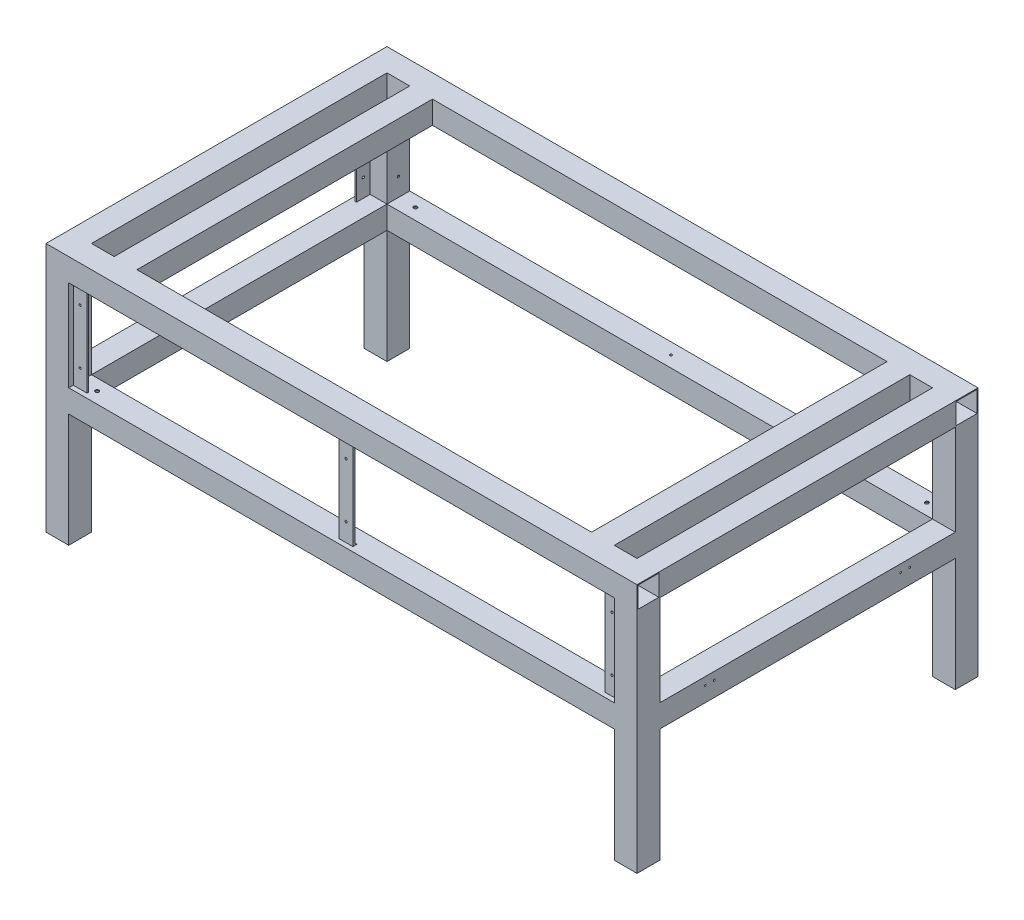
from build123d import *

# Parameters (mm, degrees)
ESQUISSE1_W                = 1300
ESQUISSE1_H                = 750
ESQUISSE1_W_2              = 1200
ESQUISSE1_H_2              = 650
BOSS_EXTRU_1_DEPTH         = 550
ESQUISSE2_W                = 1200
ESQUISSE2_H                = 200
ESQUISSE2_H_2              = 250
ENL_V_MAT_EXTRU_1_DEPTH    = 1599.436736315
ESQUISSE3_W                = 650
ESQUISSE3_H                = 200
ESQUISSE3_H_2              = 250
ENL_V_MAT_EXTRU_2_DEPTH    = 1599.436736315
ESQUISSE4_W                = 50
ESQUISSE4_H                = 650
BOSS_EXTRU_2_DEPTH         = 50
BOSS_EXTRU_2_2_DEPTH       = 50
ESQUISSE18_R               = 4
ENL_V_MAT_EXTRU_5_DEPTH    = 80
ESQUISSE19_R               = 15
ENL_V_MAT_EXTRU_6_DEPTH    = 48
ESQUISSE20_W               = 46
ESQUISSE20_H               = 46
ENL_V_MAT_EXTRU_7_DEPTH    = 10000
ESQUISSE21_W               = 46
ESQUISSE21_H               = 46
ENL_V_MAT_EXTRU_8_DEPTH    = 500
ESQUISSE22_W               = 30
ESQUISSE22_H               = 200
BOSS_EXTRU_11_DEPTH        = 3
ESQUISSE23_W               = 30
ESQUISSE23_H               = 200
ESQUISSE23_R               = 2.5
BOSS_EXTRU_12_DEPTH        = 3
ESQUISSE25_W               = 1000
ESQUISSE25_H               = 20
BOSS_EXTRU_14_DEPTH        = 3
ESQUISSE29_R               = 2.5
ENL_V_MAT_EXTRU_9_DEPTH    = 10
ESQUISSE30_R               = 2.5
ENL_V_MAT_EXTRU_10_DEPTH   = 15
ESQUISSE31_W               = 30
ESQUISSE31_H               = 5
BOSS_EXTRU_18_DEPTH        = 200
CONG_1_R                   = 5
ESQUISSE32_R               = 2.5
ENL_V_MAT_EXTRU_11_DEPTH   = 5
SYM_TRIE15_COPY_1_SKETCH_W = 30
SYM_TRIE15_COPY_1_SKETCH_H = 200
SYM_TRIE15_COPY_1_DEPTH    = 3
SYM_TRIE15_COPY_2_SKETCH_W = 30
SYM_TRIE15_COPY_2_SKETCH_H = 200
SYM_TRIE15_COPY_2_SKETCH_R = 2.5
SYM_TRIE15_COPY_2_DEPTH    = 3
SYM_TRIE15_COPY_3_SKETCH_W = 30
SYM_TRIE15_COPY_3_SKETCH_H = 200
SYM_TRIE15_COPY_3_DEPTH    = 3
SYM_TRIE15_COPY_4_SKETCH_W = 30
SYM_TRIE15_COPY_4_SKETCH_H = 200
SYM_TRIE15_COPY_4_SKETCH_R = 2.5
SYM_TRIE15_COPY_4_DEPTH    = 3
ESQUISSE33_W               = 80.648964208
ESQUISSE33_H               = 200
ENL_V_MAT_EXTRU_12_DEPTH   = 78
ESQUISSE34_R               = 2
ENL_V_MAT_EXTRU_13_DEPTH   = 25


with BuildPart() as part:
    # Esquisse1 → Boss.-Extru.1 (new body)
    with BuildSketch(Plane(origin=(0, 0, 0), x_dir=(1, 0, 0), z_dir=(0, 1, 0))):
        with Locations((650, 375)):
            Rectangle(ESQUISSE1_W, ESQUISSE1_H)
        with Locations((650, 375)):
            Rectangle(ESQUISSE1_W_2, ESQUISSE1_H_2, mode=Mode.SUBTRACT)
    extrude(amount=-BOSS_EXTRU_1_DEPTH)

    # Esquisse2 → Enlèv. mat.-Extru.1 (cut, through all)
    with BuildSketch(Plane.XY):
        with Locations((650, -150)):
            Rectangle(ESQUISSE2_W, ESQUISSE2_H)
        with Locations((650, -425)):
            Rectangle(ESQUISSE2_W, ESQUISSE2_H_2)
    extrude(amount=-ENL_V_MAT_EXTRU_1_DEPTH, mode=Mode.SUBTRACT)

    # Esquisse3 → Enlèv. mat.-Extru.2 (cut, through all)
    with BuildSketch(Plane.ZY):
        with Locations((-375, -150)):
            Rectangle(ESQUISSE3_W, ESQUISSE3_H)
        with Locations((-375, -425)):
            Rectangle(ESQUISSE3_W, ESQUISSE3_H_2)
    extrude(amount=-ENL_V_MAT_EXTRU_2_DEPTH, mode=Mode.SUBTRACT)

    # Esquisse18 → Enlèv. mat.-Extru.5 (cut)
    with BuildSketch(Plane(origin=(0, -250, 0), x_dir=(1, 0, 0), z_dir=(0, 1, 0))):
        with Locations((1212.5, 25)):
            Circle(ESQUISSE18_R)
        with Locations((87.5, 25)):
            Circle(ESQUISSE18_R)
        with Locations((87.5, 725)):
            Circle(ESQUISSE18_R)
        with Locations((1212.5, 725)):
            Circle(ESQUISSE18_R)
    extrude(amount=-ENL_V_MAT_EXTRU_5_DEPTH, mode=Mode.SUBTRACT)

    # Esquisse19 → Enlèv. mat.-Extru.6 (cut)
    with BuildSketch(Plane(origin=(0, -300, 0), x_dir=(-1, 0, 0), z_dir=(0, -1, 0))):
        with Locations((-1212.5, 725)):
            Circle(ESQUISSE19_R)
        with Locations((-87.5, 725)):
            Circle(ESQUISSE19_R)
        with Locations((-87.5, 25)):
            Circle(ESQUISSE19_R)
        with Locations((-1212.5, 25)):
            Circle(ESQUISSE19_R)
    extrude(amount=-ENL_V_MAT_EXTRU_6_DEPTH, mode=Mode.SUBTRACT)

    # Esquisse20 → Enlèv. mat.-Extru.7 (cut)
    with BuildSketch(Plane.ZY):
        with Locations((-25, -25)):
            Rectangle(ESQUISSE20_W, ESQUISSE20_H)
        with Locations((-725, -25)):
            Rectangle(ESQUISSE20_W, ESQUISSE20_H)
    extrude(amount=-ENL_V_MAT_EXTRU_7_DEPTH, mode=Mode.SUBTRACT)

    # Esquisse21 → Enlèv. mat.-Extru.8 (cut)
    with BuildSketch(Plane(origin=(0, -550, 0), x_dir=(-1, 0, 0), z_dir=(0, -1, 0))):
        with Locations((-1275, 25)):
            Rectangle(ESQUISSE21_W, ESQUISSE21_H)
        with Locations((-1275, 725)):
            Rectangle(ESQUISSE21_W, ESQUISSE21_H)
        with Locations((-25, 725)):
            Rectangle(ESQUISSE21_W, ESQUISSE21_H)
        with Locations((-25, 25)):
            Rectangle(ESQUISSE21_W, ESQUISSE21_H)
    extrude(amount=-ENL_V_MAT_EXTRU_8_DEPTH, mode=Mode.SUBTRACT)

    # Esquisse22 → Boss.-Extru.11 (add)
    with BuildSketch(Plane(origin=(0, 0, -50), x_dir=(-1, 0, 0), z_dir=(0, 0, -1))):
        with Locations((-25, -150)):
            Rectangle(ESQUISSE22_W, ESQUISSE22_H)
    boss_extru_11 = extrude(amount=BOSS_EXTRU_11_DEPTH)

    # Esquisse23 → Boss.-Extru.12 (add)
    with BuildSketch(Plane.ZY.offset(-10)):
        with Locations((-65, -150)):
            Rectangle(ESQUISSE23_W, ESQUISSE23_H)
        with Locations((-65, -90)):
            Circle(ESQUISSE23_R, mode=Mode.SUBTRACT)
        with Locations((-65, -210)):
            Circle(ESQUISSE23_R, mode=Mode.SUBTRACT)
    boss_extru_12 = extrude(amount=-BOSS_EXTRU_12_DEPTH)

    # Symétrie3: Boss.-Extru.11, Boss.-Extru.12 across plane
    add(boss_extru_11.mirror(Plane(origin=(0, 0, 0), x_dir=(-0.7071067811865475, 0, 0.7071067811865477), z_dir=(-0.7071067811865476, 0, -0.7071067811865475))))
    add(boss_extru_12.mirror(Plane(origin=(0, 0, 0), x_dir=(-0.7071067811865475, 0, 0.7071067811865477), z_dir=(-0.7071067811865476, 0, -0.7071067811865475))))



with BuildPart() as body_2:
    # Esquisse4 → Boss.-Extru.2 (new body)
    with BuildSketch(Plane(origin=(0, 0, 0), x_dir=(1, 0, 0), z_dir=(0, 1, 0))):
        with Locations((125, 375)):
            Rectangle(ESQUISSE4_W, ESQUISSE4_H)
    extrude(amount=-BOSS_EXTRU_2_DEPTH)


with BuildPart() as body_3:
    # Esquisse4 → Boss.-Extru.2 2 (new body)
    with BuildSketch(Plane(origin=(0, 0, 0), x_dir=(1, 0, 0), z_dir=(0, 1, 0))):
        with Locations((1175, 375)):
            Rectangle(ESQUISSE4_W, ESQUISSE4_H)
    extrude(amount=-BOSS_EXTRU_2_2_DEPTH)


with BuildPart() as part_1:
    add(part.part)

    add(body_2.part)  # Boss.-Extru.14 merges body 2

    add(body_3.part)  # Boss.-Extru.14 merges body 3
    # Esquisse25 → Boss.-Extru.14 (add)
    with BuildSketch(Plane(origin=(0, 0, -50), x_dir=(-1, 0, 0), z_dir=(0, 0, -1))):
        with Locations((-650, -15)):
            Rectangle(ESQUISSE25_W, ESQUISSE25_H)
    extrude(amount=BOSS_EXTRU_14_DEPTH)

    # Esquisse29 → Enlèv. mat.-Extru.9 (cut)
    with BuildSketch(Plane.ZY.offset(-1250)):
        with Locations((-725, -210)):
            Circle(ESQUISSE29_R)
        with Locations((-725, -90)):
            Circle(ESQUISSE29_R)
    enl_v_mat_extru_9 = extrude(amount=-ENL_V_MAT_EXTRU_9_DEPTH, mode=Mode.SUBTRACT)

    # Symétrie9: Enlèv. mat.-Extru.9 across plane
    add(enl_v_mat_extru_9.mirror(Plane.ZY.offset(-650)), mode=Mode.SUBTRACT)

    # Esquisse30 → Enlèv. mat.-Extru.10 (cut)
    with BuildSketch(Plane(origin=(0, -250, 0), x_dir=(1, 0, 0), z_dir=(0, 1, 0))):
        with Locations((650, 725)):
            Circle(ESQUISSE30_R)
    enl_v_mat_extru_10 = extrude(amount=-ENL_V_MAT_EXTRU_10_DEPTH, mode=Mode.SUBTRACT)

    # Symétrie10: Enlèv. mat.-Extru.10 across plane
    add(enl_v_mat_extru_10.mirror(Plane(origin=(0, -150, 0), x_dir=(0, 0, 1), z_dir=(0, -1, 0))), mode=Mode.SUBTRACT)

    # Esquisse31 → Boss.-Extru.18 (add)
    with BuildSketch(Plane(origin=(0, -250, 0), x_dir=(1, 0, 0), z_dir=(0, 1, 0))):
        with Locations((650, 12.5)):
            Rectangle(ESQUISSE31_W, ESQUISSE31_H)
    extrude(amount=BOSS_EXTRU_18_DEPTH)

    # Congé1
    cong_1_edges = [part_1.edges().sort_by_distance(p)[0] for p in [
        (650, -250, -15),
        (650, -50, -15),
    ]]
    fillet(cong_1_edges, radius=CONG_1_R)

    # Esquisse32 → Enlèv. mat.-Extru.11 (cut)
    with BuildSketch(Plane.XY.offset(-10)):
        with Locations((650, -210)):
            Circle(ESQUISSE32_R)
        with Locations((650, -90)):
            Circle(ESQUISSE32_R)
    extrude(amount=-ENL_V_MAT_EXTRU_11_DEPTH, mode=Mode.SUBTRACT)

    # Symétrie11: Boss.-Extru.12 across plane
    add(boss_extru_12.mirror(Plane.XY.offset(-375)))

    # Symétrie15 copy 1 sketch → Symétrie15 copy 1 (add)
    with BuildSketch(Plane.ZY.offset(-1250)):
        with Locations((-25, -150)):
            Rectangle(SYM_TRIE15_COPY_1_SKETCH_W, SYM_TRIE15_COPY_1_SKETCH_H)
    extrude(amount=SYM_TRIE15_COPY_1_DEPTH)

    # Symétrie15 copy 2 sketch → Symétrie15 copy 2 (add)
    with BuildSketch(Plane(origin=(1300, 0, -10), x_dir=(1, 0, 0), z_dir=(0, 0, 1))):
        with Locations((-65, -150)):
            Rectangle(SYM_TRIE15_COPY_2_SKETCH_W, SYM_TRIE15_COPY_2_SKETCH_H)
        with Locations((-65, -90)):
            Circle(SYM_TRIE15_COPY_2_SKETCH_R, mode=Mode.SUBTRACT)
        with Locations((-65, -210)):
            Circle(SYM_TRIE15_COPY_2_SKETCH_R, mode=Mode.SUBTRACT)
    extrude(amount=-SYM_TRIE15_COPY_2_DEPTH)

    # Symétrie15 copy 3 sketch → Symétrie15 copy 3 (add)
    with BuildSketch(Plane(origin=(1300, 0, -50), x_dir=(1, 0, 0), z_dir=(0, 0, -1))):
        with Locations((-25, 150)):
            Rectangle(SYM_TRIE15_COPY_3_SKETCH_W, SYM_TRIE15_COPY_3_SKETCH_H)
    extrude(amount=SYM_TRIE15_COPY_3_DEPTH)

    # Symétrie15 copy 4 sketch → Symétrie15 copy 4 (add)
    with BuildSketch(Plane(origin=(1290, 0, 0), x_dir=(0, 0, 1), z_dir=(1, 0, 0))):
        with Locations((-65, 150)):
            Rectangle(SYM_TRIE15_COPY_4_SKETCH_W, SYM_TRIE15_COPY_4_SKETCH_H)
        with Locations((-65, 90)):
            Circle(SYM_TRIE15_COPY_4_SKETCH_R, mode=Mode.SUBTRACT)
        with Locations((-65, 210)):
            Circle(SYM_TRIE15_COPY_4_SKETCH_R, mode=Mode.SUBTRACT)
    extrude(amount=-SYM_TRIE15_COPY_4_DEPTH)

    # Esquisse33 → Enlèv. mat.-Extru.12 (cut)
    with BuildSketch(Plane(origin=(1300, 0, 0), x_dir=(0, 0, -1), z_dir=(1, 0, 0))):
        with Locations((90.324482104, -150)):
            Rectangle(ESQUISSE33_W, ESQUISSE33_H)
    extrude(amount=-ENL_V_MAT_EXTRU_12_DEPTH, mode=Mode.SUBTRACT)

    # Esquisse34 → Enlèv. mat.-Extru.13 (cut)
    with BuildSketch(Plane(origin=(1300, 0, 0), x_dir=(0, 0, -1), z_dir=(1, 0, 0))):
        with Locations((150, -267)):
            Circle(ESQUISSE34_R)
        with Locations((170, -267)):
            Circle(ESQUISSE34_R)
    enl_v_mat_extru_13 = extrude(amount=-ENL_V_MAT_EXTRU_13_DEPTH, mode=Mode.SUBTRACT)

    # Symétrie16: Enlèv. mat.-Extru.13 across plane
    add(enl_v_mat_extru_13.mirror(Plane.XY.offset(-375)), mode=Mode.SUBTRACT)


solid = part_1.part
